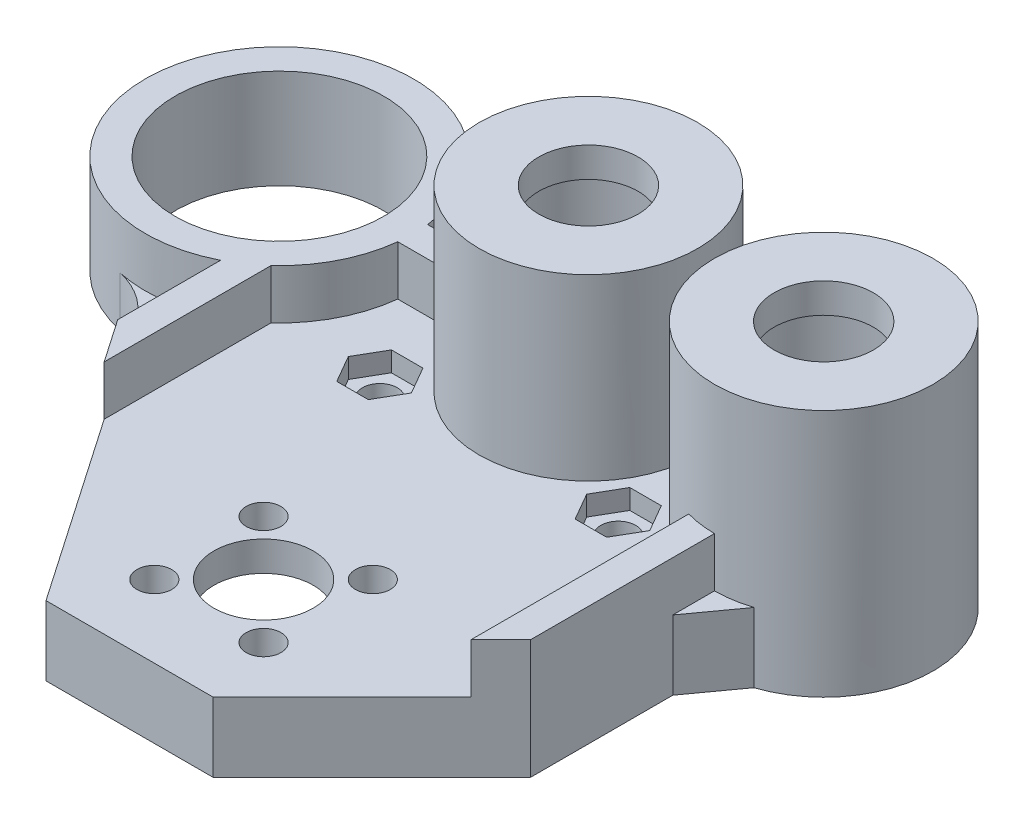
from build123d import *
from build123d.topology import SkipClean

# Parameters (mm, degrees)
SKETCH3_R               = 8
SKETCH3_W               = 54.803
SKETCH3_H               = 32
SKETCH3_R_2             = 5
BOSS_EXTRUDE1_DEPTH     = 7
CUT_EXTRUDE3_DEPTH      = 65.105926161
CUT_EXTRUDE3_DEPTH_BACK = 65.105926161
SKETCH4_R               = 1.75
SKETCH6_R               = 11
SKETCH6_R_2             = 8
BOSS_EXTRUDE2_DEPTH     = 15
SKETCH7_R               = 11
SKETCH7_R_2             = 5
BOSS_EXTRUDE3_DEPTH     = 3
CHAMFER1_SIZE           = 2.5
CUT_EXTRUDE4_DEPTH      = 2
CUT_EXTRUDE5_DEPTH      = 69.451221823
CUT_EXTRUDE5_DEPTH_BACK = 69.451221823
SKETCH9_R               = 1.75
CUT_EXTRUDE6_START      = -2
SKETCH10_R              = 1.75
CUT_EXTRUDE6_DEPTH      = 2
CHAMFER3_SIZE           = 32
CHAMFER3_SIZE2          = 22
CHAMFER4_SIZE           = 16
FILLET1_R               = 8
SKETCH12_R              = 10.5
BOSS_EXTRUDE4_DEPTH     = 5
BOSS_EXTRUDE5_DEPTH     = 5
SKETCH14_R              = 11.5
SKETCH14_R_2            = 5
SKETCH14_R_3            = 1.75
CUT_EXTRUDE7_DEPTH      = 4


with BuildPart() as part:
    # Sketch3 → Boss-Extrude1 (new body)
    # profile 1 of 10: a face of its own
    with BuildSketch(Plane(origin=(0, 0, 0), x_dir=(1, 0, 0), z_dir=(0, 1, 0))):
        with BuildLine():
            ThreePointArc((-17.613, 0), (-21.567058454, 9.545941546), (-31.113, 13.5))
            Line((-31.113, 13.5), (-31.113, 10.5))
            ThreePointArc((-31.113, 10.5), (-23.688378798, 7.424621202), (-20.613, 0))
            ThreePointArc((-20.613, 0), (-23.688378798, -7.424621202), (-31.113, -10.5))
            Line((-31.113, -10.5), (-31.113, -13.5))
            ThreePointArc((-31.113, -13.5), (-21.567058454, -9.545941546), (-17.613, 0))
        make_face()
    # profile 2 of 10: a face of its own
    with BuildSketch(Plane(origin=(0, 0, 0), x_dir=(1, 0, 0), z_dir=(0, 1, 0))):
        with BuildLine():
            Line((-31.113, 10.5), (-31.113, 13.5))
            ThreePointArc((-31.113, 13.5), (-44.613, 0), (-31.113, -13.5))
            Line((-31.113, -13.5), (-31.113, -10.5))
            ThreePointArc((-31.113, -10.5), (-41.613, 0), (-31.113, 10.5))
        make_face()
    # profile 3 of 10: a face of its own
    with BuildSketch(Plane(origin=(0, 0, 0), x_dir=(1, 0, 0), z_dir=(0, 1, 0))):
        with BuildLine():
            Line((23.69, 13.5), (-31.113, 13.5))
            ThreePointArc((-31.113, 13.5), (-21.567058454, 9.545941546), (-17.613, 0))
            ThreePointArc((-17.613, 0), (-21.567058454, -9.545941546), (-31.113, -13.5))
            Line((-31.113, -13.5), (23.69, -13.5))
            Line((23.69, -13.5), (23.69, -11))
            ThreePointArc((23.69, -11), (12.69, 0), (23.69, 11))
            Line((23.69, 11), (23.69, 13.5))
        make_face()
        with Locations(Location((0, 0, 0), (0, 0, 270))):
            Circle(SKETCH3_R, mode=Mode.SUBTRACT)
    # profile 4 of 10: a face of its own
    with BuildSketch(Plane(origin=(0, 0, 0), x_dir=(1, 0, 0), z_dir=(0, 1, 0))):
        with BuildLine():
            ThreePointArc((-17.613, 0), (-21.567058454, 9.545941546), (-31.113, 13.5))
            Line((-31.113, 13.5), (-31.113, 10.5))
            ThreePointArc((-31.113, 10.5), (-23.688378798, 7.424621202), (-20.613, 0))
            ThreePointArc((-20.613, 0), (-23.688378798, -7.424621202), (-31.113, -10.5))
            Line((-31.113, -10.5), (-31.113, -13.5))
            ThreePointArc((-31.113, -13.5), (-21.567058454, -9.545941546), (-17.613, 0))
        make_face()
    # profile 5 of 10: a face of its own
    with BuildSketch(Plane(origin=(0, 0, 0), x_dir=(1, 0, 0), z_dir=(0, 1, 0))):
        with BuildLine():
            Line((-31.113, 10.5), (-31.113, 13.5))
            ThreePointArc((-31.113, 13.5), (-44.613, 0), (-31.113, -13.5))
            Line((-31.113, -13.5), (-31.113, -10.5))
            ThreePointArc((-31.113, -10.5), (-41.613, 0), (-31.113, 10.5))
        make_face()
    # profile 6 of 10: a face of its own
    with BuildSketch(Plane(origin=(0, 0, 0), x_dir=(1, 0, 0), z_dir=(0, 1, 0))):
        with BuildLine():
            ThreePointArc((34.69, 0), (31.468174593, 7.778174593), (23.69, 11))
            Line((23.69, 11), (23.69, 8))
            ThreePointArc((23.69, 8), (29.346854249, 5.656854249), (31.69, 0))
            ThreePointArc((31.69, 0), (29.346854249, -5.656854249), (23.69, -8))
            Line((23.69, -8), (23.69, -11))
            ThreePointArc((23.69, -11), (31.468174593, -7.778174593), (34.69, 0))
        make_face()
    # profile 7 of 10: a face of its own
    with BuildSketch(Plane(origin=(0, 0, 0), x_dir=(1, 0, 0), z_dir=(0, 1, 0))):
        with BuildLine():
            Line((23.69, 8), (23.69, 11))
            ThreePointArc((23.69, 11), (12.69, 0), (23.69, -11))
            Line((23.69, -11), (23.69, -8))
            ThreePointArc((23.69, -8), (15.69, 0), (23.69, 8))
        make_face()
    # profile 8 of 10: a face of its own
    with BuildSketch(Plane(origin=(0, 0, 0), x_dir=(1, 0, 0), z_dir=(0, 1, 0))):
        with Locations((-3.7115, -29.5)):
            Rectangle(SKETCH3_W, SKETCH3_H)
        with Locations(Location((0, -32.707574931, 0), (0, 0, 270))):
            Circle(SKETCH3_R_2, mode=Mode.SUBTRACT)
    # profile 9 of 10: a face of its own
    with BuildSketch(Plane(origin=(0, 0, 0), x_dir=(1, 0, 0), z_dir=(0, 1, 0))):
        with BuildLine():
            ThreePointArc((34.69, 0), (31.468174593, 7.778174593), (23.69, 11))
            Line((23.69, 11), (23.69, 8))
            ThreePointArc((23.69, 8), (29.346854249, 5.656854249), (31.69, 0))
            ThreePointArc((31.69, 0), (29.346854249, -5.656854249), (23.69, -8))
            Line((23.69, -8), (23.69, -11))
            ThreePointArc((23.69, -11), (31.468174593, -7.778174593), (34.69, 0))
        make_face()
    # profile 10 of 10: a face of its own
    with BuildSketch(Plane(origin=(0, 0, 0), x_dir=(1, 0, 0), z_dir=(0, 1, 0))):
        with BuildLine():
            Line((23.69, 8), (23.69, 11))
            ThreePointArc((23.69, 11), (12.69, 0), (23.69, -11))
            Line((23.69, -11), (23.69, -8))
            ThreePointArc((23.69, -8), (15.69, 0), (23.69, 8))
        make_face()
    extrude(amount=BOSS_EXTRUDE1_DEPTH)

    # Sketch4 → Cut-Extrude3 (cut, two sides: drawn at the far end of the back side and taken through both)
    with BuildSketch(Plane(origin=(0, 0, 0), x_dir=(1, 0, 0), z_dir=(0, 1, 0)).offset(-CUT_EXTRUDE3_DEPTH_BACK)):
        with Locations(Location((5.5, -27.207574931, 0), (0, 0, 270))):
            Circle(SKETCH4_R)
        with Locations(Location((5.5, -38.207574931, 0), (0, 0, 270))):
            Circle(SKETCH4_R)
        with Locations(Location((-5.5, -38.207574931, 0), (0, 0, 270))):
            Circle(SKETCH4_R)
        with Locations(Location((-5.5, -27.207574931, 0), (0, 0, 270))):
            Circle(SKETCH4_R)
    extrude(amount=CUT_EXTRUDE3_DEPTH + CUT_EXTRUDE3_DEPTH_BACK, mode=Mode.SUBTRACT)

    # Sketch6 → Boss-Extrude2 (add)
    # profile 1 of 2: a face of its own
    with BuildSketch(Plane(origin=(0, 7, 0), x_dir=(1, 0, 0), z_dir=(0, 1, 0))):
        with Locations(Location((23.69, 0, 0), (0, 0, 270))):
            Circle(SKETCH6_R)
        with Locations(Location((23.69, 0, 0), (0, 0, 270))):
            Circle(SKETCH6_R_2, mode=Mode.SUBTRACT)
    # profile 2 of 2: a face of its own
    with BuildSketch(Plane(origin=(0, 7, 0), x_dir=(1, 0, 0), z_dir=(0, 1, 0))):
        with Locations(Location((0, 0, 0), (0, 0, 270))):
            Circle(SKETCH6_R)
        with Locations(Location((0, 0, 0), (0, 0, 270))):
            Circle(SKETCH6_R_2, mode=Mode.SUBTRACT)
    extrude(amount=BOSS_EXTRUDE2_DEPTH)

    # Sketch7 → Boss-Extrude3 (add)
    # profile 1 of 2: a face of its own
    with BuildSketch(Plane(origin=(0, 22, 0), x_dir=(1, 0, 0), z_dir=(0, 1, 0))):
        with Locations(Location((23.69, 0, 0), (0, 0, 270))):
            Circle(SKETCH7_R)
        with Locations(Location((23.69, 0, 0), (0, 0, 270))):
            Circle(SKETCH7_R_2, mode=Mode.SUBTRACT)
    # profile 2 of 2: a face of its own
    with BuildSketch(Plane(origin=(0, 22, 0), x_dir=(1, 0, 0), z_dir=(0, 1, 0))):
        with Locations(Location((0, 0, 0), (0, 0, 270))):
            Circle(SKETCH7_R)
        with Locations(Location((0, 0, 0), (0, 0, 270))):
            Circle(SKETCH7_R_2, mode=Mode.SUBTRACT)
    extrude(amount=BOSS_EXTRUDE3_DEPTH)

    # Chamfer1
    # the kernel refuses this chamfer: 2.5 mm, written as the material it adds along each edge
    with BuildSketch(Plane(origin=(23.69, 0, -11), x_dir=(0.9912092295509807, 0, 0.13230367815352426), z_dir=(0, 1, 0))) as chamfer1_piece_1_section:
        with BuildLine():
            Line((2.910680919, 0), (-CHAMFER1_SIZE * 0.132303678154, CHAMFER1_SIZE * 0.991209229551))
            Line((-CHAMFER1_SIZE * 0.132303678154, CHAMFER1_SIZE * 0.991209229551), (0, 0))
            ThreePointArc((0, 0), (1.49552658, 0.096625069), (2.910680919, 0))
        make_face()
    chamfer1_piece_1 = extrude(amount=7, mode=Mode.PRIVATE)
    chamfer1_piece_1 = split(chamfer1_piece_1, bisect_by=Plane(origin=(23.69, 0, -13.5), z_dir=(0, 0, 1)), keep=Keep.TOP, mode=Mode.PRIVATE)
    add(chamfer1_piece_1)

    # Sketch8 → Cut-Extrude4 (cut)
    with BuildSketch(Plane(origin=(0, 0, 0), x_dir=(1, 0, 0), z_dir=(0, 1, 0))):
        Polygon((-31.113, -11.75), (-31.113, 0), (-31.113, 11.75), (-31.113, 13.5), (-51.113, 13.5), (-51.113, -13.5), (-31.113, -13.5), align=None)
        Polygon((-31.113, 11.75), (-31.113, 0), (-31.113, -11.75), (-13.613, -6.5), (-13.613, 6.5), align=None)
    extrude(amount=CUT_EXTRUDE4_DEPTH, mode=Mode.SUBTRACT)

    # Sketch9 → Cut-Extrude5 (cut, two sides: drawn at the far end of the back side and taken through both)
    with BuildSketch(Plane(origin=(0, 0, 0), x_dir=(1, 0, 0), z_dir=(0, 1, 0)).offset(-CUT_EXTRUDE5_DEPTH_BACK)):
        with Locations(Location((12, 9, 0), (0, 0, 90))):
            Circle(SKETCH9_R)
        with Locations(Location((12, -9, 0), (0, 0, 90))):
            Circle(SKETCH9_R)
        with Locations(Location((-12, -9, 0), (0, 0, 90))):
            Circle(SKETCH9_R)
        with Locations(Location((-12, 9, 0), (0, 0, 90))):
            Circle(SKETCH9_R)
    extrude(amount=CUT_EXTRUDE5_DEPTH + CUT_EXTRUDE5_DEPTH_BACK, mode=Mode.SUBTRACT)

    # Sketch10 → Cut-Extrude6 (cut)
    # profile 1 of 4: a face of its own
    with BuildSketch(Plane(origin=(0, 7, 0), x_dir=(1, 0, 0), z_dir=(0, 1, 0)).offset(CUT_EXTRUDE6_START)):
        Polygon((-15.175426481, -9), (-13.58771324, -11.75), (-10.41228676, -11.75), (-8.824573519, -9), (-10.41228676, -6.25), (-13.58771324, -6.25), align=None)
        with Locations(Location((-12, -9, 0), (0, 0, 90))):
            Circle(SKETCH10_R, mode=Mode.SUBTRACT)
    # profile 2 of 4: a face of its own
    with BuildSketch(Plane(origin=(0, 7, 0), x_dir=(1, 0, 0), z_dir=(0, 1, 0)).offset(CUT_EXTRUDE6_START)):
        Polygon((-15.175426481, 9), (-13.58771324, 6.25), (-10.41228676, 6.25), (-8.824573519, 9), (-10.41228676, 11.75), (-13.58771324, 11.75), align=None)
        with Locations(Location((-12, 9, 0), (0, 0, 90))):
            Circle(SKETCH10_R, mode=Mode.SUBTRACT)
    # profile 3 of 4: a face of its own
    with BuildSketch(Plane(origin=(0, 7, 0), x_dir=(1, 0, 0), z_dir=(0, 1, 0)).offset(CUT_EXTRUDE6_START)):
        Polygon((15.175426481, 9), (13.58771324, 11.75), (10.41228676, 11.75), (8.824573519, 9), (10.41228676, 6.25), (13.58771324, 6.25), align=None)
        with Locations(Location((12, 9, 0), (0, 0, 90))):
            Circle(SKETCH10_R, mode=Mode.SUBTRACT)
    # profile 4 of 4: a face of its own
    with BuildSketch(Plane(origin=(0, 7, 0), x_dir=(1, 0, 0), z_dir=(0, 1, 0)).offset(CUT_EXTRUDE6_START)):
        Polygon((15.175426481, -9), (13.58771324, -6.25), (10.41228676, -6.25), (8.824573519, -9), (10.41228676, -11.75), (13.58771324, -11.75), align=None)
        with Locations(Location((12, -9, 0), (0, 0, 90))):
            Circle(SKETCH10_R, mode=Mode.SUBTRACT)
    extrude(amount=CUT_EXTRUDE6_DEPTH, mode=Mode.SUBTRACT)

    # Chamfer2
    # the kernel refuses this chamfer: 5 mm, written as the material it adds along each edge
    with BuildSketch(Plane(origin=(23.69, 0, 11), x_dir=(0.9874000606639179, 0, -0.15824386307497393), z_dir=(0, 1, 0))) as chamfer2_piece_1:
        with BuildLine():
            Line((3.622786344, 0.141421356), (-0.805837357, -4.287202344))
            Line((-0.805837357, -4.287202344), (-0.904577363, -4.271377958))
            ThreePointArc((-0.904577363, -4.271377958), (-0.443767224, -2.137054655), (-0.098740006, 0.015824386))
            Line((-0.098740006, 0.015824386), (0.015824386, 0.098740006))
            ThreePointArc((0.015824386, 0.098740006), (1.81210794, -0.038365312), (3.606961958, 0.240161362))
            Line((3.606961958, 0.240161362), (3.622786344, 0.141421356))
        make_face()
    extrude(amount=7)

    # Chamfer3
    chamfer3_edges = [part.edges().sort_by_distance(p)[0] for p in [
        (-31.113, 3.5, 45.5),
    ]]
    chamfer3_side = [part.faces().sort_by_distance(p)[0] for p in [
        (-31.113, 3.461538462, 29.240384615),
    ]]
    chamfer(chamfer3_edges, length=CHAMFER3_SIZE, length2=CHAMFER3_SIZE2, reference=chamfer3_side[0])

    # Chamfer4
    chamfer4_edges = [part.edges().sort_by_distance(p)[0] for p in [
        (23.69, 3.5, 45.5),
    ]]
    chamfer(chamfer4_edges, length=CHAMFER4_SIZE)

    # Fillet1
    fillet1_edges = [part.edges().sort_by_distance(p)[0] for p in [
        (-31.113, 4.5, 13.5),
    ]]
    fillet(fillet1_edges, radius=FILLET1_R)

    # Sketch12 → Boss-Extrude4 (add)
    # profile 1 of 4: a face of its own
    with BuildSketch(Plane(origin=(0, 7, 0), x_dir=(1, 0, 0), z_dir=(0, 1, 0))):
        with BuildLine():
            ThreePointArc((11, 0), (10.974281775, -0.751757625), (10.897247359, -1.5))
            Line((10.897247359, -1.5), (12.792752641, -1.5))
            ThreePointArc((12.792752641, -1.5), (12.69, 0), (12.792752641, 1.5))
            Line((12.792752641, 1.5), (10.897247359, 1.5))
            ThreePointArc((10.897247359, 1.5), (10.974281775, 0.751757625), (11, 0))
        make_face()
    # profile 2 of 4: a face of its own
    with BuildSketch(Plane(origin=(0, 7, 0), x_dir=(1, 0, 0), z_dir=(0, 1, 0))):
        with BuildLine():
            ThreePointArc((-17.613, 0), (-17.633914234, -0.751163705), (-17.696592135, -1.5))
            Line((-17.696592135, -1.5), (-10.897247359, -1.5))
            ThreePointArc((-10.897247359, -1.5), (-11, 0), (-10.897247359, 1.5))
            Line((-10.897247359, 1.5), (-17.696592135, 1.5))
            ThreePointArc((-17.696592135, 1.5), (-17.633914234, 0.751163705), (-17.613, 0))
        make_face()
    # profile 3 of 4: a face of its own
    with BuildSketch(Plane(origin=(0, 7, 0), x_dir=(1, 0, 0), z_dir=(0, 1, 0))):
        with BuildLine():
            Line((-17.696592135, -1.5), (-19.418433475, -1.5))
            Line((-19.418433475, -1.5), (-19.418433475, 1.5))
            Line((-19.418433475, 1.5), (-17.696592135, 1.5))
            ThreePointArc((-17.696592135, 1.5), (-22.113, 10.062305899), (-31.113, 13.5))
            ThreePointArc((-31.113, 13.5), (-44.536619079, 1.434033058), (-33.96483904, -13.19534062))
            ThreePointArc((-33.96483904, -13.19534062), (-23.232785747, -10.961396961), (-17.696592135, -1.5))
        make_face()
        with Locations(Location((-31.113, 0, 0), (0, 0, 270))):
            Circle(SKETCH12_R, mode=Mode.SUBTRACT)
    # profile 4 of 4: a face of its own
    with BuildSketch(Plane(origin=(0, 7, 0), x_dir=(1, 0, 0), z_dir=(0, 1, 0))):
        with BuildLine():
            Line((-19.418433475, 1.5), (-19.418433475, -1.5))
            Line((-19.418433475, -1.5), (-17.696592135, -1.5))
            ThreePointArc((-17.696592135, -1.5), (-17.633914234, -0.751163705), (-17.613, 0))
            ThreePointArc((-17.613, 0), (-17.633914234, 0.751163705), (-17.696592135, 1.5))
            Line((-17.696592135, 1.5), (-19.418433475, 1.5))
        make_face()
    extrude(amount=BOSS_EXTRUDE4_DEPTH)

    # Sketch13 → Boss-Extrude5 (add)
    with BuildSketch(Plane(origin=(0, 7, 0), x_dir=(1, 0, 0), z_dir=(0, 1, 0))):
        with BuildLine():
            Line((23.69, -29.5), (23.69, -15.198684154))
            Line((23.69, -15.198684154), (23.69, -11))
            ThreePointArc((23.69, -11), (22.175578937, -10.895252583), (20.69, -10.583005244))
            Line((20.69, -10.583005244), (20.69, -32.5))
            Line((20.69, -32.5), (23.69, -29.5))
        make_face()
        with BuildLine():
            Line((-25, -22.391636364), (-22, -26.755272727))
            Line((-22, -26.755272727), (-22, -9.960081877))
            ThreePointArc((-22, -9.960081877), (-23.429523235, -11.100188503), (-25, -12.036661954))
            Line((-25, -12.036661954), (-25, -22.391636364))
        make_face()
    extrude(amount=BOSS_EXTRUDE5_DEPTH)

    # Sketch14 → Cut-Extrude7 (cut)
    with SkipClean():  # the faces are left unmerged after this step: merging them gives an invalid solid
        with BuildSketch(Plane.XZ):
            with Locations(Location((0, 32.707574931, 0), (0, 0, 270))):
                Circle(SKETCH14_R)
            with Locations(Location((0, 32.707574931, 0), (0, 0, 270))):
                Circle(SKETCH14_R_2, mode=Mode.SUBTRACT)
            with Locations(Location((5.5, 38.207574931, 0), (0, 0, 270))):
                Circle(SKETCH14_R_3, mode=Mode.SUBTRACT)
            with Locations(Location((-5.5, 27.207574931, 0), (0, 0, 270))):
                Circle(SKETCH14_R_3, mode=Mode.SUBTRACT)
            with Locations(Location((-5.5, 38.207574931, 0), (0, 0, 270))):
                Circle(SKETCH14_R_3, mode=Mode.SUBTRACT)
            with Locations(Location((5.5, 27.207574931, 0), (0, 0, 270))):
                Circle(SKETCH14_R_3, mode=Mode.SUBTRACT)
        extrude(amount=-CUT_EXTRUDE7_DEPTH, mode=Mode.SUBTRACT)


solid = part.part
